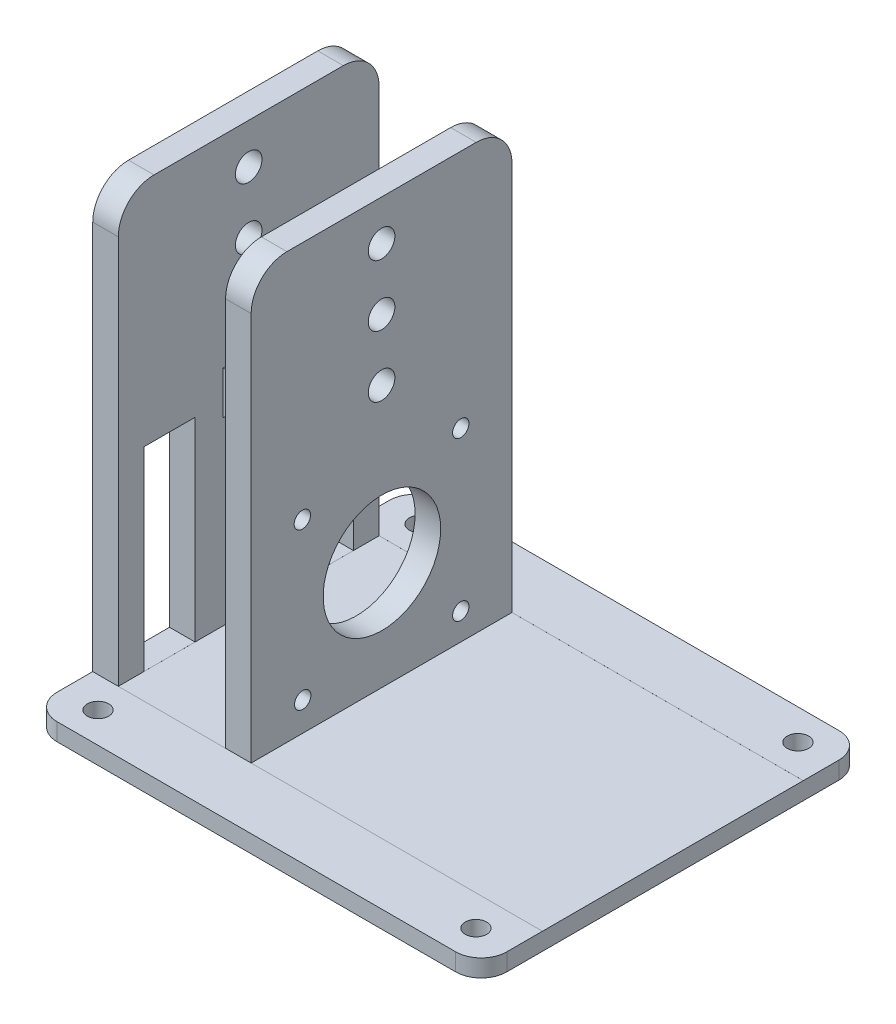
from build123d import *

# Parameters (mm, degrees)
SKETCH1_W                = 88.006134304
SKETCH1_H                = 51.04430696
BOSS_EXTRUDE1_DEPTH      = 3.406110275
SKETCH2_W                = 5
SKETCH2_H                = 51.04430696
BOSS_EXTRUDE3_DEPTH      = 83.180869555
SKETCH8_R                = 11.5
CUT_EXTRUDE3_DEPTH       = 107.763218116
CUT_EXTRUDE4_DEPTH       = 107.763218116
CUT_EXTRUDE4_DEPTH_BACK  = 107.763218116
SKETCH9_R                = 1.6
SKETCH17_W               = 51.04430696
SKETCH17_H               = 86.58697983
BOSS_EXTRUDE4_DEPTH      = 5
FILLET2_R                = 7
FILLET4_R                = 7
FILLET5_R                = 7
FILLET6_R                = 7
SKETCH27_W               = 88.006134304
SKETCH27_H               = 11.97784652
BOSS_EXTRUDE7_DEPTH      = 3.41
CUT_EXTRUDE10_DEPTH      = 102.299442144
CUT_EXTRUDE10_DEPTH_BACK = 102.299442144
SKETCH28_R               = 2.1
FILLET7_R                = 5
CUT_EXTRUDE12_DEPTH      = 111.241799805
CUT_EXTRUDE12_DEPTH_BACK = 111.241799805
SKETCH20_R               = 2.605
SKETCH29_W               = 10
SKETCH29_H               = 2.944957488
BOSS_EXTRUDE10_DEPTH     = 25
BOSS_EXTRUDE11_DEPTH     = 10
SKETCH35_W               = 10
SKETCH35_H               = 38.088489915
CUT_EXTRUDE14_DEPTH      = 11
BOSS_EXTRUDE12_DEPTH     = 10


with BuildPart() as part:
    # Sketch1 → Boss-Extrude1 (new body)
    with BuildSketch(Plane(origin=(0, 0, 0), x_dir=(1, 0, 0), z_dir=(0, 1, 0))):
        Rectangle(SKETCH1_W, SKETCH1_H)
    extrude(amount=BOSS_EXTRUDE1_DEPTH)

    # Sketch2 → Boss-Extrude3 (add)
    with BuildSketch(Plane(origin=(0, 3.406110275, 0), x_dir=(1, 0, 0), z_dir=(0, 1, 0))):
        with Locations((-15.503067152, 0)):
            Rectangle(SKETCH2_W, SKETCH2_H)
    extrude(amount=BOSS_EXTRUDE3_DEPTH)

    # Sketch8 → Cut-Extrude3 (cut, through all)
    with BuildSketch(Plane(origin=(-13.003067152, 0, 0), x_dir=(0, 0, -1), z_dir=(1, 0, 0))):
        with Locations((0.071404436, 24.556110275)):
            Circle(SKETCH8_R)
    extrude(amount=-CUT_EXTRUDE3_DEPTH, mode=Mode.SUBTRACT)

    # Sketch9 → Cut-Extrude4 (cut, two sides: drawn at the far end of the back side and taken through both)
    with BuildSketch(Plane(origin=(-13.003067152, 0, 0), x_dir=(0, 0, -1), z_dir=(1, 0, 0)).offset(-CUT_EXTRUDE4_DEPTH_BACK)):
        with Locations((-15.428595564, 9.056110275)):
            Circle(SKETCH9_R)
        with Locations((-15.49999857, 39.65)):
            Circle(SKETCH9_R)
        with Locations((15.49999857, 39.65)):
            Circle(SKETCH9_R)
        with Locations((15.49999857, 8.65)):
            Circle(SKETCH9_R)
    extrude(amount=CUT_EXTRUDE4_DEPTH + CUT_EXTRUDE4_DEPTH_BACK, mode=Mode.SUBTRACT)

    # Sketch17 → Boss-Extrude4 (add)
    with BuildSketch(Plane(origin=(-44.003067152, -0.060669127, 0), x_dir=(0, 0, 1), z_dir=(-1, 0, 0))):
        with Locations((0, 43.354159042)):
            Rectangle(SKETCH17_W, SKETCH17_H)
    extrude(amount=-BOSS_EXTRUDE4_DEPTH)

    # Fillet2
    fillet2_edges = [part.edges().sort_by_distance(p)[0] for p in [
        (-15.503067152, 86.586979829, 25.52215348),
    ]]
    fillet(fillet2_edges, radius=FILLET2_R)

    # Fillet4
    fillet4_edges = [part.edges().sort_by_distance(p)[0] for p in [
        (-41.503067152, 86.586979829, 25.52215348),
    ]]
    fillet(fillet4_edges, radius=FILLET4_R)

    # Fillet5
    fillet5_edges = [part.edges().sort_by_distance(p)[0] for p in [
        (-15.503067152, 86.586979829, -25.52215348),
    ]]
    fillet(fillet5_edges, radius=FILLET5_R)

    # Fillet6
    fillet6_edges = [part.edges().sort_by_distance(p)[0] for p in [
        (-41.503067152, 86.586979829, -25.52215348),
    ]]
    fillet(fillet6_edges, radius=FILLET6_R)

    # Sketch27 → Boss-Extrude7 (add)
    with BuildSketch(Plane.XZ):
        with Locations((0, -31.51107674)):
            Rectangle(SKETCH27_W, SKETCH27_H)
        with Locations((0, 31.51107674)):
            Rectangle(SKETCH27_W, SKETCH27_H)
    extrude(amount=-BOSS_EXTRUDE7_DEPTH)

    # Sketch28 → Cut-Extrude10 (cut, two sides: drawn at the far end of the back side and taken through both)
    with BuildSketch(Plane(origin=(0, 3.406110275, 0), x_dir=(1, 0, 0), z_dir=(0, 1, 0)).offset(-CUT_EXTRUDE10_DEPTH_BACK)):
        with Locations((36.975574022, 31.51107674)):
            Circle(SKETCH28_R)
        with Locations((-36.975574022, 31.51107674)):
            Circle(SKETCH28_R)
        with Locations((-36.975574022, -31.51107674)):
            Circle(SKETCH28_R)
        with Locations((36.975574022, -31.51107674)):
            Circle(SKETCH28_R)
    extrude(amount=CUT_EXTRUDE10_DEPTH + CUT_EXTRUDE10_DEPTH_BACK, mode=Mode.SUBTRACT)

    # Fillet7
    fillet7_edges = [part.edges().sort_by_distance(p)[0] for p in [
        (44.003067152, 1.705, -37.5),
        (-44.003067152, 1.705, -37.5),
        (-44.003067152, 1.705, 37.5),
        (44.003067152, 1.705, 37.5),
    ]]
    fillet(fillet7_edges, radius=FILLET7_R)

    # Sketch20 → Cut-Extrude12 (cut, two sides: drawn at the far end of the back side and taken through both)
    with BuildSketch(Plane(origin=(-13.003067152, 0, 0), x_dir=(0, 0, -1), z_dir=(1, 0, 0)).offset(-CUT_EXTRUDE12_DEPTH_BACK)):
        with Locations((0, 78.681208122)):
            Circle(SKETCH20_R)
        with Locations((0, 66.681208122)):
            Circle(SKETCH20_R)
        with Locations((0, 54.681208122)):
            Circle(SKETCH20_R)
    extrude(amount=CUT_EXTRUDE12_DEPTH + CUT_EXTRUDE12_DEPTH_BACK, mode=Mode.SUBTRACT)

    # Sketch29 → Boss-Extrude10 (add)
    with BuildSketch(Plane(origin=(-39.003067152, 0, 0), x_dir=(0, 0, -1), z_dir=(1, 0, 0))):
        with Locations((0, 45.632148018)):
            Rectangle(SKETCH29_W, SKETCH29_H)
    extrude(amount=BOSS_EXTRUDE10_DEPTH)

    # Sketch34 → Boss-Extrude11 (add)
    with BuildSketch(Plane.XY.offset(5)):
        Polygon((-33.503067152, 44.159669274), (-39.003067152, 38.659669274), (-39.003067152, 41.659669274), (-36.503067152, 44.159669274), align=None)
        Polygon((-23.664246511, 44.159669274), (-18.003067152, 38.498489915), (-18.003067152, 41.498489915), (-20.664246511, 44.159669274), align=None)
    extrude(amount=-BOSS_EXTRUDE11_DEPTH)

    # Sketch35 → Cut-Extrude14 (cut)
    with BuildSketch(Plane.ZY.offset(44.003067152)):
        with Locations((-15.49999857, 22.454244958)):
            Rectangle(SKETCH35_W, SKETCH35_H)
        with Locations((15.49999857, 22.454244958)):
            Rectangle(SKETCH35_W, SKETCH35_H)
    extrude(amount=-CUT_EXTRUDE14_DEPTH, mode=Mode.SUBTRACT)

    # Sketch36 → Boss-Extrude12 (add)
    with BuildSketch(Plane.XY.offset(5)):
        Polygon((-36.503067152, 44.159669274), (-39.003067152, 44.159669274), (-39.003067152, 41.659669274), align=None)
        Polygon((-20.664246511, 44.159669274), (-18.003067152, 44.159669274), (-18.003067152, 41.498489915), align=None)
    extrude(amount=-BOSS_EXTRUDE12_DEPTH)


solid = part.part
